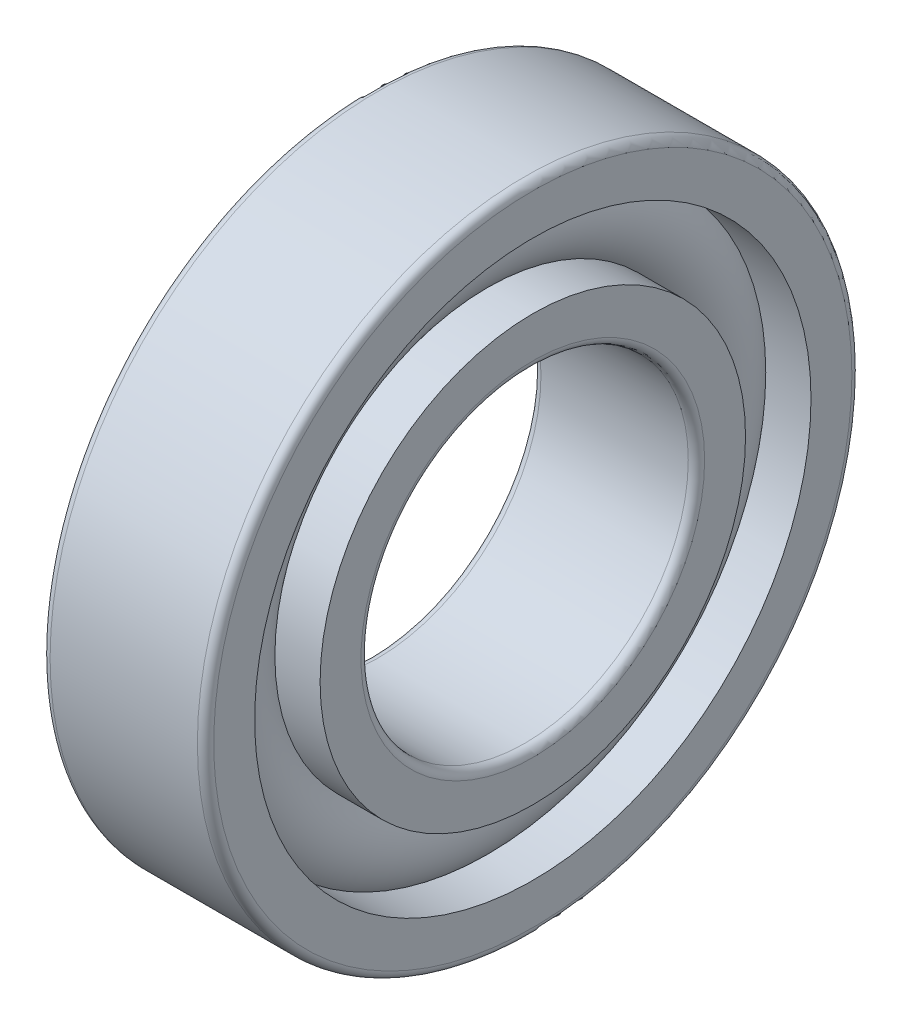
from build123d import *

# Parameters (mm, degrees)
CAGSPISKE_W     = 0.24
CAGSPISKE_H     = 0.4
CAGESPINE_ANGLE = 0.001
BALSIMSKE_R     = 1.2


with BuildPart() as part:
    # CagSpiSke → CageSpine (revolve)
    with BuildSketch(Plane.XY):
        with Locations((0, 6)):
            Rectangle(CAGSPISKE_W, CAGSPISKE_H)
    revolve(axis=Axis((-20.6375, 0, 0), (-1, 0, 0)), revolution_arc=CAGESPINE_ANGLE)

    # BalSimSke → BallsSimplified (revolve)
    with BuildSketch(Plane.XY):
        with Locations((0, 6)):
            Circle(BALSIMSKE_R)
    revolve(axis=Axis((-10, 0, 0), (1, 0, 0)))

    # InnRacSke → InnerRace (revolve)
    with BuildSketch(Plane.XY):
        with BuildLine():
            Line((-0.860595724, 5.2), (-2, 5.2))
            Line((-2, 5.2), (-2, 4.2))
            ThreePointArc((-2, 4.2), (-1.941421356, 4.058578644), (-1.8, 4))
            Line((-1.8, 4), (1.8, 4))
            ThreePointArc((1.8, 4), (1.941421356, 4.058578644), (2, 4.2))
            Line((2, 4.2), (2, 5.2))
            Line((2, 5.2), (0.860595724, 5.2))
            ThreePointArc((0.860595724, 5.2), (0, 4.825), (-0.860595724, 5.2))
        make_face()
    revolve(axis=Axis((-20.6375, 0, 0), (1, 0, 0)))

    # OutRacSke → OuterRace (revolve)
    with BuildSketch(Plane.XY):
        with BuildLine():
            Line((-0.860595724, 6.8), (-2, 6.8))
            Line((-2, 6.8), (-2, 7.8))
            ThreePointArc((-2, 7.8), (-1.941421356, 7.941421356), (-1.8, 8))
            Line((-1.8, 8), (1.8, 8))
            ThreePointArc((1.8, 8), (1.941421356, 7.941421356), (2, 7.8))
            Line((2, 7.8), (2, 6.8))
            Line((2, 6.8), (0.860595724, 6.8))
            ThreePointArc((0.860595724, 6.8), (0, 7.175), (-0.860595724, 6.8))
        make_face()
    revolve(axis=Axis((-20.6375, 0, 0), (1, 0, 0)))


solid = part.part
